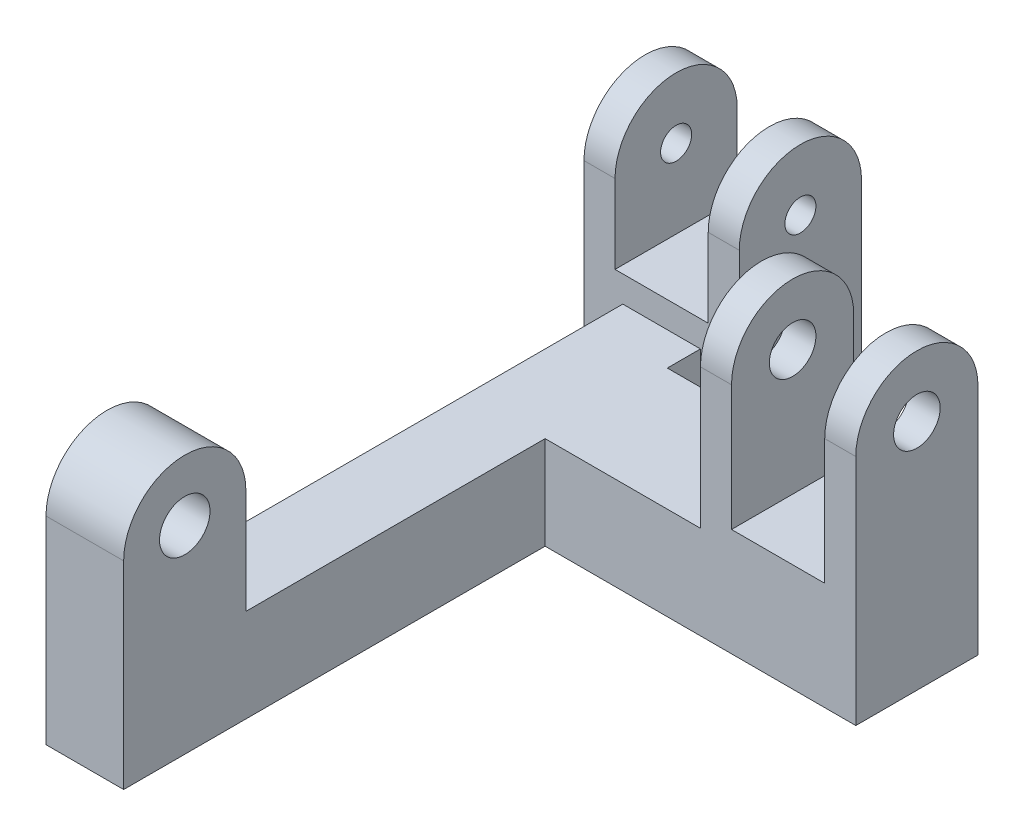
from build123d import *
from build123d.topology import SkipClean

# Parameters (mm, degrees)
SKETCH1_R                      = 1.5
BOSS_EXTRUDE1_DEPTH            = 5
CUT_EXTRUDE1_DEPTH             = 17.293347298
CUT_EXTRUDE1_DEPTH_BACK        = 17.293347298
SKETCH2_W                      = 6
SKETCH2_H                      = 12
SKETCH5_W                      = 7.867189124
SKETCH5_H                      = 6
BOSS_EXTRUDE2_DEPTH            = 10
SKETCH6_R                      = 1
SKETCH6_R_2                    = 1.625
BOSS_EXTRUDE3_DEPTH            = 5
BOSS_EXTRUDE4_DEPTH            = 2.5
BOSS_EXTRUDE4_DEPTH_BACK       = 7.5
SKETCH7_R                      = 1
CUT_EXTRUDE2_REACH             = 54.5
SKETCH8_W                      = 6
SKETCH8_H                      = 9
CUT_EXTRUDE2_DIRECTION_2_DEPTH = 53.5


with BuildPart() as part:
    # Sketch1 → Boss-Extrude1 (new, symmetric)
    with BuildSketch(Plane(origin=(0, 0, 0), x_dir=(0, 0, -1), z_dir=(1, 0, 0))):
        with BuildLine():
            Line((3.933594562, 0), (3.933594562, -15))
            Line((3.933594562, -15), (-3.933594562, -15))
            Line((-3.933594562, -15), (-3.933594562, 0))
            ThreePointArc((-3.933594562, 0), (0, 3.933594562), (3.933594562, 0))
        make_face()
        Circle(SKETCH1_R, mode=Mode.SUBTRACT)
    extrude(amount=BOSS_EXTRUDE1_DEPTH, both=True)

    # Sketch2 → Cut-Extrude1 (cut, two sides: drawn at the far end of the back side and taken through both)
    with BuildSketch(Plane.XY.offset(-CUT_EXTRUDE1_DEPTH_BACK)):
        with Locations((0, -2.066405438)):
            Rectangle(SKETCH2_W, SKETCH2_H)
    extrude(amount=CUT_EXTRUDE1_DEPTH + CUT_EXTRUDE1_DEPTH_BACK, mode=Mode.SUBTRACT)

    # Sketch5 → Boss-Extrude2 (add)
    with BuildSketch(Plane.ZY.offset(5)):
        with Locations((0, -12)):
            Rectangle(SKETCH5_W, SKETCH5_H)
    extrude(amount=BOSS_EXTRUDE2_DEPTH)

    # Sketch6 → Boss-Extrude3 (add)
    with BuildSketch(Plane.ZY.offset(15)):
        with BuildLine():
            Line((23.199216315, -9), (-6.066405438, -9))
            Line((-6.066405438, -9), (-6.066405438, -2.25))
            ThreePointArc((-6.066405438, -2.25), (-10, 1.683594562), (-13.933594562, -2.25))
            Line((-13.933594562, -2.25), (-13.933594562, -6.757725184))
            Line((-13.933594562, -6.757725184), (-13.933594562, -15))
            Line((-13.933594562, -15), (31.066405438, -15))
            Line((31.066405438, -15), (31.066405438, -6.757725184))
            Line((31.066405438, -6.757725184), (31.066405438, -2.25))
            ThreePointArc((31.066405438, -2.25), (27.132810876, 1.683594562), (23.199216315, -2.25))
            Line((23.199216315, -2.25), (23.199216315, -9))
        make_face()
        with Locations((-10, -2.25)):
            Circle(SKETCH6_R, mode=Mode.SUBTRACT)
        with Locations((27.132810876, -2.25)):
            Circle(SKETCH6_R_2, mode=Mode.SUBTRACT)
    extrude(amount=BOSS_EXTRUDE3_DEPTH)

    # Sketch7 → Boss-Extrude4 (add, two sides: drawn at the far end of the back side and taken through both)
    with SkipClean():  # the faces are left unmerged after this step: merging them gives an invalid solid
        with BuildSketch(Plane.ZY.offset(20).offset(-BOSS_EXTRUDE4_DEPTH_BACK)):
            with BuildLine():
                Line((-13.933594562, -15), (-13.933594562, -2.25))
                ThreePointArc((-13.933594562, -2.25), (-10, 1.683594562), (-6.066405438, -2.25))
                Line((-6.066405438, -2.25), (-6.066405438, -15))
                Line((-6.066405438, -15), (-13.933594562, -15))
            make_face()
            with Locations((-10, -2.25)):
                Circle(SKETCH7_R, mode=Mode.SUBTRACT)
        extrude(amount=BOSS_EXTRUDE4_DEPTH + BOSS_EXTRUDE4_DEPTH_BACK)
    add(part.part.scale(1), mode=Mode.REPLACE)  # the faces are merged on a copy

    # Sketch8 → Cut-Extrude2 (cut, up to next)
    with BuildSketch(Plane(origin=(0, 0, -13.933594562), x_dir=(-1, 0, 0), z_dir=(0, 0, -1)), mode=Mode.PRIVATE) as cut_extrude2_sk1:
        with Locations((17.5, -2.816405438)):
            Rectangle(SKETCH8_W, SKETCH8_H)
    cut_extrude2_tool1 = extrude(cut_extrude2_sk1.sketch, amount=-CUT_EXTRUDE2_REACH, mode=Mode.PRIVATE) & part.part
    add(cut_extrude2_tool1.solids().sort_by_distance((-17.5, -2.816405, -13.933595))[0], mode=Mode.SUBTRACT)

    # Sketch8 → Cut-Extrude2 direction 2 (cut)
    with BuildSketch(Plane(origin=(0, 0, -13.933594562), x_dir=(-1, 0, 0), z_dir=(0, 0, -1))):
        with Locations((17.5, -2.816405438)):
            Rectangle(SKETCH8_W, SKETCH8_H)
    extrude(amount=CUT_EXTRUDE2_DIRECTION_2_DEPTH, mode=Mode.SUBTRACT)


solid = part.part
